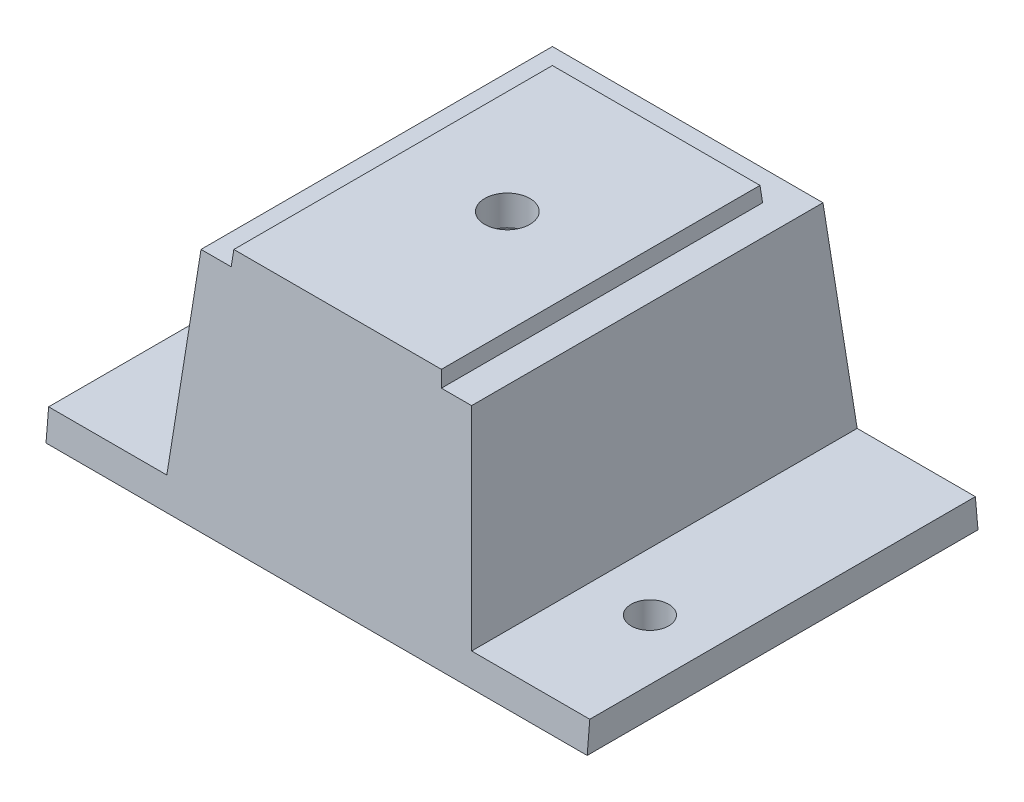
from build123d import *

# Parameters (mm, degrees)
BOSS_EXTRUDE1_DEPTH     = 82.55
SHELL1_START            = 6.35
SHELL1_DEPTH            = 69.85
SKETCH4_W               = 176.485735693
SKETCH4_H               = 90.097834431
CUT_EXTRUDE1_DEPTH      = 25.4
CUT_EXTRUDE2_DEPTH      = 113.522286681
CUT_EXTRUDE2_DEPTH_BACK = 113.522286681
SKETCH8_R               = 4.7625
SKETCH8_R_2             = 3.96875
CUT_EXTRUDE3_DEPTH      = 113.522286681


# Read off the part's stored shape, not the designer's step: Shell1
with BuildPart() as part:
    # Sketch1 → Boss-Extrude1 (new body)
    with BuildSketch(Plane.XY):
        Polygon((57.15, 0), (-57.15, 0), (-57.15, 6.35), (-32.186094587, 6.35), (-28.575, 47.625), (-22.200744032, 47.625), (-21.922967525, 50.8), (21.922967525, 50.8), (22.200744032, 47.625), (28.575, 47.625), (32.186094587, 6.35), (57.15, 6.35), align=None)
    extrude(amount=BOSS_EXTRUDE1_DEPTH)

    # Shell1 outline → Shell1 (cut)
    with BuildSketch(Plane.XY.offset(SHELL1_START)):
        Polygon((26.367391632, 0), (22.756297045, 41.275), (16.382041077, 41.275), (16.10426457, 44.45), (-16.10426457, 44.45), (-16.382041077, 41.275), (-22.756297045, 41.275), (-26.367391632, 0), align=None)
    extrude(amount=SHELL1_DEPTH, mode=Mode.SUBTRACT)

    # Sketch4 → Cut-Extrude1 (cut)
    with BuildSketch(Plane(origin=(0, 0, 0), x_dir=(1, 0, 0), z_dir=(0, 0.08715574274765504, -0.9961946980917459))):
        with Locations((12.432297096, -27.899571849)):
            Rectangle(SKETCH4_W, SKETCH4_H)
    cut_extrude1 = extrude(amount=CUT_EXTRUDE1_DEPTH, mode=Mode.SUBTRACT)

    # Sketch7 → Cut-Extrude2 (cut, two sides: drawn at the far end of the back side and taken through both)
    with BuildSketch(Plane(origin=(0, 0, 0), x_dir=(0, 0, -1), z_dir=(1, 0, 0)).offset(-CUT_EXTRUDE2_DEPTH_BACK)):
        Polygon((-4.1666476, 47.625), (-10.540903569, 47.625), (-10.818680076, 50.8), (-4.444424107, 50.8), align=None)
    extrude(amount=CUT_EXTRUDE2_DEPTH + CUT_EXTRUDE2_DEPTH_BACK, mode=Mode.SUBTRACT)

    # Mirror1: Cut-Extrude1 across plane
    add(cut_extrude1.mirror(Plane.XY.offset(41.275)), mode=Mode.SUBTRACT)

    # Sketch8 → Cut-Extrude3 (cut, through all)
    with BuildSketch(Plane(origin=(0, 50.8, 0), x_dir=(1, 0, 0), z_dir=(0, 1, 0))):
        with Locations(Location((0, -42.2666476, 0), (0, 0, 270))):
            Circle(SKETCH8_R)
        with Locations(Location((44.45, -56.594446987, 0), (0, 0, 270))):
            Circle(SKETCH8_R_2)
        with Locations(Location((-44.45, -56.594446987, 0), (0, 0, 270))):
            Circle(SKETCH8_R_2)
    extrude(amount=-CUT_EXTRUDE3_DEPTH, mode=Mode.SUBTRACT)


solid = part.part
